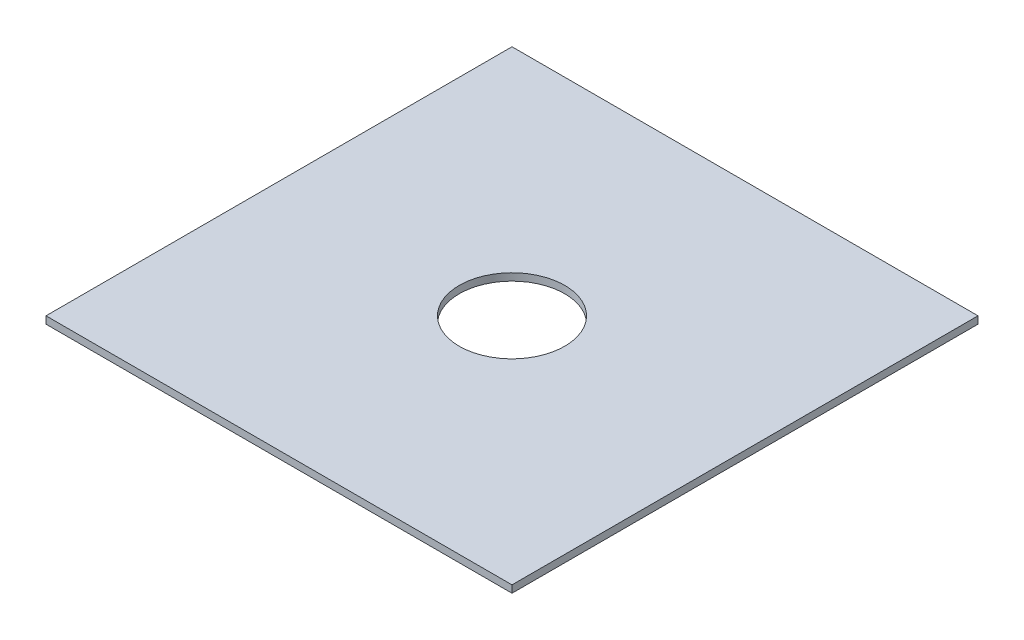
from build123d import *

# Parameters (mm, degrees)
SKETCH1_W           = 406.4
SKETCH1_H           = 406.4
BOSS_EXTRUDE1_DEPTH = 6.35
CUT_EXTRUDE1_REACH  = 456.413
SKETCH2_R           = 46


with BuildPart() as part:
    # Sketch1 → Boss-Extrude1 (new body)
    with BuildSketch(Plane(origin=(0, 0, 0), x_dir=(1, 0, 0), z_dir=(0, 1, 0))):
        with Locations((0, 203.2)):
            Rectangle(SKETCH1_W, SKETCH1_H)
    extrude(amount=BOSS_EXTRUDE1_DEPTH)

    # Sketch2 → Cut-Extrude1 (cut, up to next)
    with BuildSketch(Plane(origin=(0, 6.35, 0), x_dir=(1, 0, 0), z_dir=(0, 1, 0)), mode=Mode.PRIVATE) as cut_extrude1_sk1:
        with Locations((0, 203.2)):
            Circle(SKETCH2_R)
    cut_extrude1_tool1 = extrude(cut_extrude1_sk1.sketch, amount=-CUT_EXTRUDE1_REACH, mode=Mode.PRIVATE) & part.part
    add(cut_extrude1_tool1.solids().sort_by_distance((0, 6.35, -203.2))[0], mode=Mode.SUBTRACT)


solid = part.part
